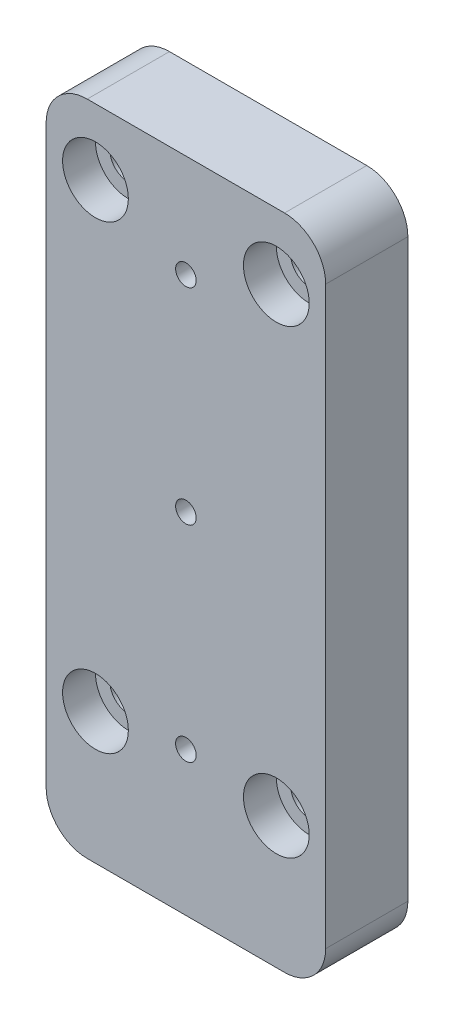
from build123d import *

# Parameters (mm, degrees)
ESQUISSE1_W                  = 34
ESQUISSE1_H                  = 80
BOSS_EXTRU_1_DEPTH           = 10
ENL_V_MAT_EXTRU_1_DEPTH      = 88.498571417
ENL_V_MAT_EXTRU_1_DEPTH_BACK = 88.498571417
ESQUISSE2_R                  = 1.25
ENL_V_MAT_EXTRU_2_DEPTH      = 88.498571417
ENL_V_MAT_EXTRU_2_DEPTH_BACK = 88.498571417
ESQUISSE3_R                  = 2.25
ESQUISSE4_R                  = 4
ENL_V_MAT_EXTRU_3_DEPTH      = 4
CONG_1_R                     = 5


with BuildPart() as part:
    # Esquisse1 → Boss.-Extru.1 (new body)
    with BuildSketch(Plane.XY):
        with Locations((17, 40)):
            Rectangle(ESQUISSE1_W, ESQUISSE1_H)
    extrude(amount=BOSS_EXTRU_1_DEPTH)

    # Esquisse2 → Enlèv. mat.-Extru.1 (cut, two sides: drawn at the far end of the back side and taken through both)
    with BuildSketch(Plane.XY.offset(10).offset(-ENL_V_MAT_EXTRU_1_DEPTH_BACK)):
        with Locations((17, 17.5)):
            Circle(ESQUISSE2_R)
        with Locations((17, 42.5)):
            Circle(ESQUISSE2_R)
        with Locations((17, 67.5)):
            Circle(ESQUISSE2_R)
        with Locations((17, 92.5)):
            Circle(ESQUISSE2_R)
        with Locations((17, 117.5)):
            Circle(ESQUISSE2_R)
        with Locations((17, 142.5)):
            Circle(ESQUISSE2_R)
        with Locations((17, 167.5)):
            Circle(ESQUISSE2_R)
        with Locations((17, 192.5)):
            Circle(ESQUISSE2_R)
    extrude(amount=ENL_V_MAT_EXTRU_1_DEPTH + ENL_V_MAT_EXTRU_1_DEPTH_BACK, mode=Mode.SUBTRACT)

    # Esquisse3 → Enlèv. mat.-Extru.2 (cut, two sides: drawn at the far end of the back side and taken through both)
    with BuildSketch(Plane.XY.offset(10).offset(-ENL_V_MAT_EXTRU_2_DEPTH_BACK)):
        with Locations((6, 16)):
            Circle(ESQUISSE3_R)
        with Locations((28, 16)):
            Circle(ESQUISSE3_R)
        with Locations((28, 72)):
            Circle(ESQUISSE3_R)
        with Locations((6, 72)):
            Circle(ESQUISSE3_R)
    extrude(amount=ENL_V_MAT_EXTRU_2_DEPTH + ENL_V_MAT_EXTRU_2_DEPTH_BACK, mode=Mode.SUBTRACT)

    # Esquisse4 → Enlèv. mat.-Extru.3 (cut)
    with BuildSketch(Plane.XY.offset(10)):
        with Locations((6, 16)):
            Circle(ESQUISSE4_R)
        with Locations((28, 16)):
            Circle(ESQUISSE4_R)
        with Locations((6, 72)):
            Circle(ESQUISSE4_R)
        with Locations((28, 72)):
            Circle(ESQUISSE4_R)
    extrude(amount=-ENL_V_MAT_EXTRU_3_DEPTH, mode=Mode.SUBTRACT)

    # Congé1
    cong_1_edges = [part.edges().sort_by_distance(p)[0] for p in [
        (0, 80, 5),
        (34, 80, 5),
        (34, 0, 5),
        (0, 0, 5),
    ]]
    fillet(cong_1_edges, radius=CONG_1_R)


solid = part.part
